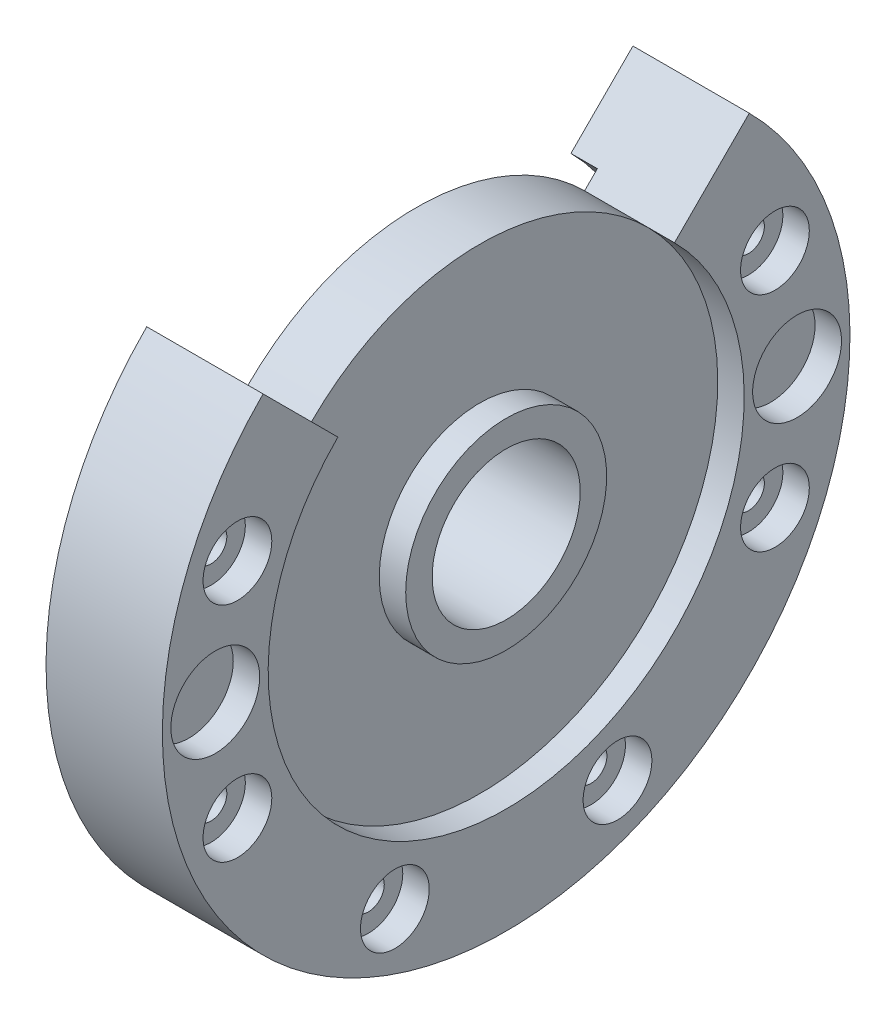
from build123d import *

# Parameters (mm, degrees)
REVOLUCI_N1_OUTLINE_R     = 32.5
REVOLUCI_N1_DEPTH         = 8.5
REVOLUCI_N1_START         = 8.5
REVOLUCI_N1_2_OUTLINE_R   = 32.5
REVOLUCI_N1_2_OUTLINE_R_2 = 22.5
REVOLUCI_N1_2_OUTLINE_R_3 = 9.5
REVOLUCI_N1_2_DEPTH       = 2.5
CROQUIS2_R                = 7
CROQUIS2_R_2              = 1.5
CORTAR_EXTRUIR1_DEPTH     = 16
CORTAR_EXTRUIR2_START     = -16
CORTAR_EXTRUIR2_DEPTH     = 16
CORTAR_EXTRUIR4_DEPTH     = 2.5
CROQUIS7_R                = 3.25
CORTAR_EXTRUIR6_DEPTH     = 2.5
CROQUIS9_R                = 24.21
CROQUIS9_R_2              = 18.21
CORTAR_EXTRUIR7_DEPTH     = 2.5


# Read off the part's stored shape, not the designer's step: Revolución1
with BuildPart() as part:
    # Revolución1 outline → Revolución1 (new body)
    with BuildSketch(Plane.YZ):
        Circle(REVOLUCI_N1_OUTLINE_R)
    extrude(amount=REVOLUCI_N1_DEPTH)

    # Revoluci_n1 2 outline → Revoluci_n1 2 (add)
    # profile 1 of 2: a face of its own
    with BuildSketch(Plane.YZ.offset(REVOLUCI_N1_START)):
        Circle(REVOLUCI_N1_2_OUTLINE_R)
        Circle(REVOLUCI_N1_2_OUTLINE_R_2, mode=Mode.SUBTRACT)
    # profile 2 of 2: a face of its own
    with BuildSketch(Plane.YZ.offset(REVOLUCI_N1_START)):
        Circle(REVOLUCI_N1_2_OUTLINE_R_3)
    extrude(amount=REVOLUCI_N1_2_DEPTH)

    # Croquis2 → Cortar-Extruir1 (cut)
    with BuildSketch(Plane(origin=(11, 0, 0), x_dir=(0, 0, -1), z_dir=(1, 0, 0))):
        Circle(CROQUIS2_R)
        with Locations((25.406687144, -10.52379439)):
            Circle(CROQUIS2_R_2)
        with Locations((10.52379439, -25.406687144)):
            Circle(CROQUIS2_R_2)
        with Locations((-10.52379439, -25.406687144)):
            Circle(CROQUIS2_R_2)
        with Locations((-25.406687144, -10.52379439)):
            Circle(CROQUIS2_R_2)
        with Locations((-25.406687144, 10.52379439)):
            Circle(CROQUIS2_R_2)
        with Locations((25.406687144, 10.52379439)):
            Circle(CROQUIS2_R_2)
    extrude(amount=-CORTAR_EXTRUIR1_DEPTH, mode=Mode.SUBTRACT)

    # Croquis3 → Cortar-Extruir2 (cut)
    with BuildSketch(Plane(origin=(11, 0, 0), x_dir=(0, 0, -1), z_dir=(1, 0, 0)).offset(CORTAR_EXTRUIR2_START)):
        with BuildLine():
            Line((-22.980970389, 22.980970389), (-15.909902577, 15.909902577))
            ThreePointArc((-15.909902577, 15.909902577), (0, 22.5), (15.909902577, 15.909902577))
            Line((15.909902577, 15.909902577), (22.980970389, 22.980970389))
            ThreePointArc((22.980970389, 22.980970389), (0, 32.5), (-22.980970389, 22.980970389))
        make_face()
    extrude(amount=CORTAR_EXTRUIR2_DEPTH, mode=Mode.SUBTRACT)

    # Croquis5 → Cortar-Extruir4 (cut)
    with BuildSketch(Plane(origin=(11, 0, 0), x_dir=(0, 0, -1), z_dir=(1, 0, 0))):
        with BuildLine():
            ThreePointArc((31.7, 0), (27.5, 4.2), (23.3, 0))
            Line((23.3, 0), (31.7, 0))
        make_face()
        with BuildLine():
            Line((31.7, 0), (23.3, 0))
            ThreePointArc((23.3, 0), (27.5, -4.2), (31.7, 0))
        make_face()
        with BuildLine():
            ThreePointArc((-31.7, 0), (-27.5, -4.2), (-23.3, 0))
            Line((-23.3, 0), (-31.7, 0))
        make_face()
        with BuildLine():
            Line((-31.7, 0), (-23.3, 0))
            ThreePointArc((-23.3, 0), (-27.5, 4.2), (-31.7, 0))
        make_face()
    extrude(amount=-CORTAR_EXTRUIR4_DEPTH, mode=Mode.SUBTRACT)

    # Croquis7 → Cortar-Extruir6 (cut)
    with BuildSketch(Plane(origin=(11, 0, 0), x_dir=(0, 0, -1), z_dir=(1, 0, 0))):
        with Locations((25.406687144, -10.52379439)):
            Circle(CROQUIS7_R)
        with Locations((10.52379439, -25.406687144)):
            Circle(CROQUIS7_R)
        with Locations((-10.52379439, -25.406687144)):
            Circle(CROQUIS7_R)
        with Locations((-25.406687144, -10.52379439)):
            Circle(CROQUIS7_R)
        with Locations((-25.406687144, 10.52379439)):
            Circle(CROQUIS7_R)
        with Locations((25.406687144, 10.52379439)):
            Circle(CROQUIS7_R)
    extrude(amount=-CORTAR_EXTRUIR6_DEPTH, mode=Mode.SUBTRACT)

    # Croquis9 → Cortar-Extruir7 (cut)
    with BuildSketch(Plane.ZY):
        Circle(CROQUIS9_R)
        Circle(CROQUIS9_R_2, mode=Mode.SUBTRACT)
    extrude(amount=-CORTAR_EXTRUIR7_DEPTH, mode=Mode.SUBTRACT)


solid = part.part
